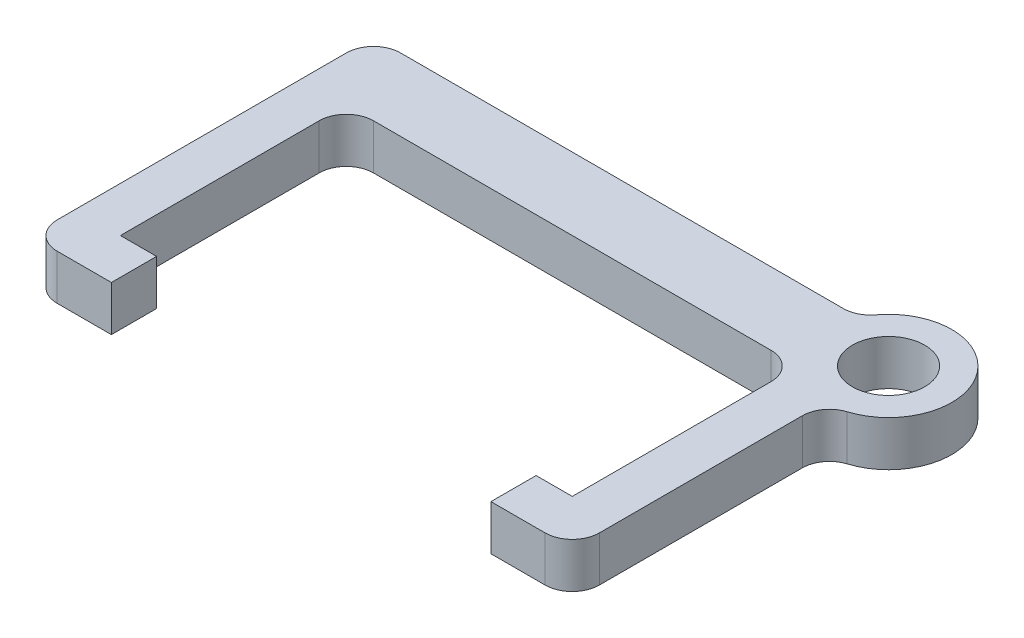
from build123d import *

# Parameters (mm, degrees)
SKETCH1_R           = 4
BOSS_EXTRUDE1_DEPTH = 5


with BuildPart() as part:
    # Sketch1 → Boss-Extrude1 (new body)
    with BuildSketch(Plane(origin=(0, 0, 0), x_dir=(1, 0, 0), z_dir=(0, 1, 0))):
        with BuildLine():
            ThreePointArc((5, -3), (5.878679656, -0.878679656), (8, 0))
            Line((8, 0), (52, 0))
            ThreePointArc((52, 0), (54.121320344, -0.878679656), (55, -3))
            Line((55, -3), (55, -25))
            Line((55, -25), (51, -25))
            Line((51, -25), (51, -30))
            Line((51, -30), (55, -30))
            Line((55, -30), (57, -30))
            ThreePointArc((57, -30), (59.121320344, -29.121320344), (60, -27))
            Line((60, -27), (60, -4.539392014))
            ThreePointArc((60, -4.539392014), (60.581322676, -2.764568079), (62.1, -1.67757441))
            ThreePointArc((62.1, -1.67757441), (65.713397086, 9.044390404), (54.4, 9.2))
            ThreePointArc((54.4, 9.2), (53.341640786, 8.316718427), (52, 8))
            Line((52, 8), (3, 8))
            ThreePointArc((3, 8), (0.878679656, 7.121320344), (0, 5))
            Line((0, 5), (0, 2))
            Line((0, 2), (0, -27))
            ThreePointArc((0, -27), (0.878679656, -29.121320344), (3, -30))
            Line((3, -30), (9, -30))
            Line((9, -30), (9, -25))
            Line((9, -25), (5, -25))
            Line((5, -25), (5, -3))
        make_face()
        with Locations((60, 5)):
            Circle(SKETCH1_R, mode=Mode.SUBTRACT)
    extrude(amount=BOSS_EXTRUDE1_DEPTH)


solid = part.part
